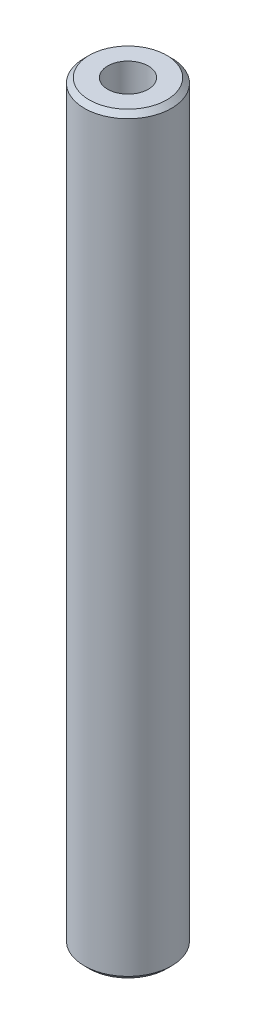
from build123d import *

# Parameters (mm, degrees)
SKETCH1_R           = 10
BOSS_EXTRUDE1_DEPTH = 172.776034835
SKETCH2_R           = 4.655488089
CUT_EXTRUDE1_DEPTH  = 174.353852606
CHAMFER1_SIZE       = 1.113173512


with BuildPart() as part:
    # Sketch1 → Boss-Extrude1 (new body)
    with BuildSketch(Plane(origin=(0, 0, 0), x_dir=(1, 0, 0), z_dir=(0, 1, 0))):
        Circle(SKETCH1_R)
    extrude(amount=BOSS_EXTRUDE1_DEPTH)

    # Sketch2 → Cut-Extrude1 (cut, through all)
    with BuildSketch(Plane(origin=(0, 0, 0), x_dir=(1, 0, 0), z_dir=(0, 1, 0))):
        Circle(SKETCH2_R)
    extrude(amount=CUT_EXTRUDE1_DEPTH, mode=Mode.SUBTRACT)

    # Chamfer1
    chamfer1_edges = [part.edges().sort_by_distance(p)[0] for p in [
        (-10, 172.776034835, 0),
        (-10, 0, 0),
    ]]
    chamfer(chamfer1_edges, length=CHAMFER1_SIZE)


solid = part.part
